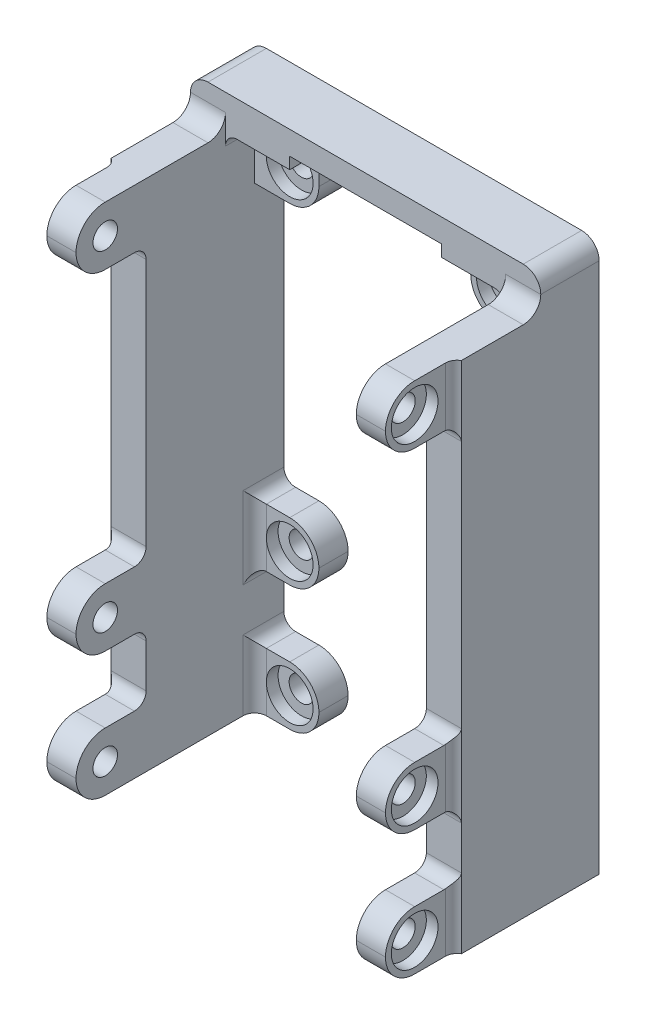
from build123d import *

# Parameters (mm, degrees)
SKETCH1_W               = 3
SKETCH1_H               = 44
BOSS_EXTRUDE1_DEPTH     = 11.8
BOSS_EXTRUDE1_2_DEPTH   = 11.8
SKETCH2_W               = 30
SKETCH2_H               = 3
BOSS_EXTRUDE2_DEPTH     = 5
SKETCH3_W               = 2.5
SKETCH3_H               = 5
BOSS_EXTRUDE3_DEPTH     = 6
CUT_EXTRUDE1_DEPTH      = 43.568650437
CUT_EXTRUDE1_DEPTH_BACK = 43.568650437
SKETCH4_R               = 1.05
SKETCH5_W               = 5.5
SKETCH5_H               = 5
SKETCH5_R               = 1.05
BOSS_EXTRUDE4_DEPTH     = 2.5
FILLET1_R               = 2.5
FILLET2_R               = 2.5
FILLET3_R               = 1.5
SKETCH8_R               = 2
CUT_EXTRUDE2_DEPTH      = 1
SKETCH9_R               = 2
CUT_EXTRUDE3_DEPTH      = 1
FILLET4_R               = 1
SKETCH10_W              = 13
SKETCH10_H              = 1
CUT_EXTRUDE4_DEPTH      = 35.159039843


# Some blends are built 0.0001 mm under size
with BuildPart() as part:
    # Sketch1 → Boss-Extrude1 (new body)
    with BuildSketch(Plane.XY):
        with Locations((-13.5, 0)):
            Rectangle(SKETCH1_W, SKETCH1_H)
    extrude(amount=BOSS_EXTRUDE1_DEPTH)



with BuildPart() as body_2:
    # Sketch1 → Boss-Extrude1 2 (new body)
    with BuildSketch(Plane.XY):
        with Locations((13.5, 0)):
            Rectangle(SKETCH1_W, SKETCH1_H)
    extrude(amount=BOSS_EXTRUDE1_2_DEPTH)


with BuildPart() as part_1:
    add(part.part)

    add(body_2.part)  # Boss-Extrude2 merges body 2
    # Sketch2 → Boss-Extrude2 (add)
    with BuildSketch(Plane(origin=(0, 0, 0), x_dir=(-1, 0, 0), z_dir=(0, 0, -1))):
        with Locations((0, 23.5)):
            Rectangle(SKETCH2_W, SKETCH2_H)
    extrude(amount=-BOSS_EXTRUDE2_DEPTH)

    # Sketch3 → Boss-Extrude3 (add)
    with BuildSketch(Plane.XY.offset(11.8)):
        with Locations((-13.25, 19.5)):
            Rectangle(SKETCH3_W, SKETCH3_H)
        with Locations((-13.25, -8.8)):
            Rectangle(SKETCH3_W, SKETCH3_H)
        with Locations((-13.25, -19.5)):
            Rectangle(SKETCH3_W, SKETCH3_H)
        with Locations((13.25, -19.5)):
            Rectangle(SKETCH3_W, SKETCH3_H)
        with Locations((13.25, -8.8)):
            Rectangle(SKETCH3_W, SKETCH3_H)
        with Locations((13.25, 19.5)):
            Rectangle(SKETCH3_W, SKETCH3_H)
    extrude(amount=BOSS_EXTRUDE3_DEPTH)

    # Sketch4 → Cut-Extrude1 (cut, two sides: drawn at the far end of the back side and taken through both)
    with BuildSketch(Plane.ZY.offset(14.5).offset(-CUT_EXTRUDE1_DEPTH_BACK)):
        with Locations((15.3, 19.5)):
            Circle(SKETCH4_R)
        with Locations((15.3, -8.8)):
            Circle(SKETCH4_R)
        with Locations((15.3, -19.5)):
            Circle(SKETCH4_R)
    extrude(amount=CUT_EXTRUDE1_DEPTH + CUT_EXTRUDE1_DEPTH_BACK, mode=Mode.SUBTRACT)

    # Sketch5 → Boss-Extrude4 (add)
    # profile 1 of 6: a face of its own
    with BuildSketch(Plane(origin=(0, 0, 0), x_dir=(-1, 0, 0), z_dir=(0, 0, -1))):
        with Locations((-9.25, 19.5)):
            Rectangle(SKETCH5_W, SKETCH5_H)
        with Locations((-9, 19.5)):
            Circle(SKETCH5_R, mode=Mode.SUBTRACT)
    # profile 2 of 6: a face of its own
    with BuildSketch(Plane(origin=(0, 0, 0), x_dir=(-1, 0, 0), z_dir=(0, 0, -1))):
        with Locations((9.25, 19.5)):
            Rectangle(SKETCH5_W, SKETCH5_H)
        with Locations(Location((9, 19.5, 0), (0, 0, 180))):
            Circle(SKETCH5_R, mode=Mode.SUBTRACT)
    # profile 3 of 6: a face of its own
    with BuildSketch(Plane(origin=(0, 0, 0), x_dir=(-1, 0, 0), z_dir=(0, 0, -1))):
        with Locations((-9.25, -8.8)):
            Rectangle(SKETCH5_W, SKETCH5_H)
        with Locations((-9, -8.8)):
            Circle(SKETCH5_R, mode=Mode.SUBTRACT)
    # profile 4 of 6: a face of its own
    with BuildSketch(Plane(origin=(0, 0, 0), x_dir=(-1, 0, 0), z_dir=(0, 0, -1))):
        with Locations((-9.25, -19.5)):
            Rectangle(SKETCH5_W, SKETCH5_H)
        with Locations((-9, -19.5)):
            Circle(SKETCH5_R, mode=Mode.SUBTRACT)
    # profile 5 of 6: a face of its own
    with BuildSketch(Plane(origin=(0, 0, 0), x_dir=(-1, 0, 0), z_dir=(0, 0, -1))):
        with Locations((9.25, -8.8)):
            Rectangle(SKETCH5_W, SKETCH5_H)
        with Locations(Location((9, -8.8, 0), (0, 0, 180))):
            Circle(SKETCH5_R, mode=Mode.SUBTRACT)
    # profile 6 of 6: a face of its own
    with BuildSketch(Plane(origin=(0, 0, 0), x_dir=(-1, 0, 0), z_dir=(0, 0, -1))):
        with Locations((9.25, -19.5)):
            Rectangle(SKETCH5_W, SKETCH5_H)
        with Locations(Location((9, -19.5, 0), (0, 0, 180))):
            Circle(SKETCH5_R, mode=Mode.SUBTRACT)
    extrude(amount=-BOSS_EXTRUDE4_DEPTH)

    # Fillet1
    fillet1_edges = [part_1.edges().sort_by_distance(p)[0] for p in [
        (6.5, 17, 1.25),
        (6.5, -6.3, 1.25),
        (6.5, -11.3, 1.25),
        (6.5, -17, 1.25),
        (6.5, -22, 1.25),
        (-6.5, -22, 1.25),
        (-6.5, -17, 1.25),
        (-6.5, -11.3, 1.25),
        (-6.5, -6.3, 1.25),
        (-6.5, 17, 1.25),
    ]]
    fillet(fillet1_edges, radius=FILLET1_R - 0.0001)  # a hair under: the kernel refuses the full size

    # Fillet2
    fillet2_edges = [part_1.edges().sort_by_distance(p)[0] for p in [
        (13.25, -6.3, 17.8),
        (13.25, -11.3, 17.8),
        (13.25, -17, 17.8),
        (13.25, -22, 17.8),
        (-13.25, -22, 17.8),
        (-13.25, -17, 17.8),
        (-13.25, -11.3, 17.8),
        (-13.25, -6.3, 17.8),
        (13.25, 22, 17.8),
        (13.25, 17, 17.8),
        (-13.25, 17, 17.8),
        (-13.25, 22, 17.8),
    ]]
    fillet(fillet2_edges, radius=FILLET2_R - 0.0001)  # a hair under: the kernel refuses the full size

    # Fillet3
    # the kernel refuses this fillet: 1.5 mm, written as the material it adds along each edge
    with BuildSketch(Plane(origin=(-12, 22, 5), x_dir=(0, 1, 0), z_dir=(-1, 0, 0))) as fillet3_piece_1:
        with BuildLine():
            CenterArc((FILLET3_R, -FILLET3_R), FILLET3_R, 90, 90)
            Line((0, -FILLET3_R), (0, 0))
            Line((0, 0), (FILLET3_R, 0))
        make_face()
    extrude(amount=3)
    with BuildSketch(Plane(origin=(15, 22, 5), x_dir=(0, 0, 1), z_dir=(-1, 0, 0))) as fillet3_piece_2:
        with BuildLine():
            CenterArc((FILLET3_R, FILLET3_R), FILLET3_R, 180, 90)
            Line((0, FILLET3_R), (0, 0))
            Line((0, 0), (FILLET3_R, 0))
        make_face()
    extrude(amount=3)
    # the kernel refuses this fillet: 1.5 mm, written as the material it takes off along each edge
    with BuildSketch(Plane(origin=(15, 25, -3.75), x_dir=(0, -1, 0), z_dir=(0, 0, 1))) as fillet3_2_piece_1:
        with BuildLine():
            CenterArc((FILLET3_R, -FILLET3_R), FILLET3_R, 90, 90)
            Line((0, -FILLET3_R), (0, 0))
            Line((0, 0), (FILLET3_R, 0))
        make_face()
    extrude(amount=12.5, mode=Mode.SUBTRACT)
    with BuildSketch(Plane(origin=(-15, 25, -3.75), x_dir=(0, -1, 0), z_dir=(0, 0, 1))) as fillet3_2_piece_2:
        with BuildLine():
            CenterArc((FILLET3_R, FILLET3_R), FILLET3_R, 180, 90)
            Line((0, FILLET3_R), (0, 0))
            Line((0, 0), (FILLET3_R, 0))
        make_face()
    extrude(amount=12.5, mode=Mode.SUBTRACT)

    # Sketch8 → Cut-Extrude2 (cut)
    with BuildSketch(Plane.ZY.offset(14.5)):
        with Locations((15.3, 19.5)):
            Circle(SKETCH8_R)
        with Locations((15.3, -8.8)):
            Circle(SKETCH8_R)
        with Locations((15.3, -19.5)):
            Circle(SKETCH8_R)
    cut_extrude2 = extrude(amount=-CUT_EXTRUDE2_DEPTH, mode=Mode.SUBTRACT)

    # Sketch9 → Cut-Extrude3 (cut)
    with BuildSketch(Plane.XY.offset(2.5)):
        with Locations((-9, 19.5)):
            Circle(SKETCH9_R)
        with Locations((-9, -8.8)):
            Circle(SKETCH9_R)
        with Locations((-9, -19.5)):
            Circle(SKETCH9_R)
    cut_extrude3 = extrude(amount=-CUT_EXTRUDE3_DEPTH, mode=Mode.SUBTRACT)

    # Mirror1: Cut-Extrude2, Cut-Extrude3 across plane
    add(cut_extrude2.mirror(Plane(origin=(0, 0, 0), x_dir=(0, 0, 1), z_dir=(1, 0, 0))), mode=Mode.SUBTRACT)
    add(cut_extrude3.mirror(Plane(origin=(0, 0, 0), x_dir=(0, 0, 1), z_dir=(1, 0, 0))), mode=Mode.SUBTRACT)

    # Fillet4
    # the kernel refuses this fillet: 1 mm, written as the material it adds along each edge
    with BuildSketch(Plane(origin=(12, 22, 0), x_dir=(0, -1, 0), z_dir=(0, 0, 1)), Plane(origin=(12, -11.3, 2.5), x_dir=(0, 0, 1), z_dir=(0, 1, 0)), Plane(origin=(12, -22, 2.5), x_dir=(0, 0, 1), z_dir=(0, 1, 0))) as fillet4_piece_1:
        with BuildLine():
            CenterArc((FILLET4_R, -FILLET4_R), FILLET4_R, 90, 90)
            Line((0, -FILLET4_R), (0, 0))
            Line((0, 0), (FILLET4_R, 0))
        make_face()
    extrude(amount=5)
    with BuildSketch(Plane(origin=(-12, 22, 0), x_dir=(0, -1, 0), z_dir=(0, 0, 1)), Plane(origin=(-12, -22, 2.5), x_dir=(0, 0, 1), z_dir=(0, 1, 0)), Plane(origin=(-12, -11.3, 2.5), x_dir=(0, 0, 1), z_dir=(0, 1, 0))) as fillet4_piece_2:
        with BuildLine():
            CenterArc((FILLET4_R, FILLET4_R), FILLET4_R, 180, 90)
            Line((0, FILLET4_R), (0, 0))
            Line((0, 0), (FILLET4_R, 0))
        make_face()
    extrude(amount=5)
    with BuildSketch(Plane(origin=(12, -6.3, 0), x_dir=(0, 1, 0), z_dir=(0, 0, 1)), Plane(origin=(12, -17, 0), x_dir=(0, 1, 0), z_dir=(0, 0, 1)), Plane(origin=(-12, -11.3, 0), x_dir=(0, -1, 0), z_dir=(0, 0, 1)), Plane(origin=(-14.5, 17, 11.8), x_dir=(0, 0, 1), z_dir=(1, 0, 0))) as fillet4_piece_3:
        with BuildLine():
            CenterArc((FILLET4_R, FILLET4_R), FILLET4_R, 180, 90)
            Line((0, FILLET4_R), (0, 0))
            Line((0, 0), (FILLET4_R, 0))
        make_face()
    extrude(amount=2.5)
    with BuildSketch(Plane(origin=(12, -11.3, 0), x_dir=(0, -1, 0), z_dir=(0, 0, 1)), Plane(origin=(-12, -17, 0), x_dir=(0, 1, 0), z_dir=(0, 0, 1)), Plane(origin=(-12, -6.3, 0), x_dir=(0, 1, 0), z_dir=(0, 0, 1)), Plane(origin=(-12, -6.3, 11.8), x_dir=(0, 1, 0), z_dir=(-1, 0, 0)), Plane(origin=(-12, -17, 11.8), x_dir=(0, 1, 0), z_dir=(-1, 0, 0)), Plane(origin=(14.5, -17, 11.8), x_dir=(0, 1, 0), z_dir=(-1, 0, 0)), Plane(origin=(14.5, -6.3, 11.8), x_dir=(0, 1, 0), z_dir=(-1, 0, 0)), Plane(origin=(-14.5, -11.3, 11.8), x_dir=(0, -1, 0), z_dir=(1, 0, 0)), Plane(origin=(12, -11.3, 11.8), x_dir=(0, -1, 0), z_dir=(1, 0, 0)), Plane(origin=(12, 17, 11.8), x_dir=(0, -1, 0), z_dir=(1, 0, 0))) as fillet4_piece_4:
        with BuildLine():
            CenterArc((FILLET4_R, -FILLET4_R), FILLET4_R, 90, 90)
            Line((0, -FILLET4_R), (0, 0))
            Line((0, 0), (FILLET4_R, 0))
        make_face()
    extrude(amount=2.5)
    with BuildSketch(Plane(origin=(-14.5, 22, 11.8), x_dir=(-1, 0, 0), z_dir=(0, -1, 0)), Plane(origin=(-14.5, -6.3, 11.8), x_dir=(-1, 0, 0), z_dir=(0, -1, 0)), Plane(origin=(-14.5, -17, 11.8), x_dir=(-1, 0, 0), z_dir=(0, -1, 0)), Plane(origin=(14.5, -22, 11.8), x_dir=(1, 0, 0), z_dir=(0, 1, 0)), Plane(origin=(14.5, -11.3, 11.8), x_dir=(1, 0, 0), z_dir=(0, 1, 0))) as fillet4_piece_5:
        with BuildLine():
            CenterArc((1, -0.866025404), FILLET4_R, 120, 60)
            Line((0, -0.866025404), (0, 0))
            Line((0, 0), (0.5, 0))
        make_face()
    extrude(amount=5)
    with BuildSketch(Plane(origin=(14.5, 17, 11.8), x_dir=(0, 0, 1), z_dir=(0, 1, 0))) as fillet4_piece_6:
        with BuildLine():
            CenterArc((0.866025404, 1), FILLET4_R, 210, 60)
            Line((0, 0.5), (0, 0))
            Line((0, 0), (0.866025404, 0))
        make_face()
    extrude(amount=5)
    with BuildSketch(Plane(origin=(12, -11.3, 2.5), x_dir=(0, 0, 1), z_dir=(0, 1, 0))) as fillet4_piece_7a_section:
        with BuildLine():
            CenterArc((FILLET4_R, -FILLET4_R), FILLET4_R, 90, 90)
            Line((0, -FILLET4_R), (0, 0))
            Line((0, 0), (FILLET4_R, 0))
        make_face()
    fillet4_piece_7a = extrude(amount=7.5, mode=Mode.PRIVATE)
    fillet4_piece_7a = split(fillet4_piece_7a, bisect_by=Plane(origin=(12, -6.3, 2.5), z_dir=(0, 1, 0)), keep=Keep.TOP, mode=Mode.PRIVATE)
    with BuildSketch(Plane(origin=(12, -6.3, 0), x_dir=(0, 1, 0), z_dir=(0, 0, 1))) as fillet4_piece_7b_section:
        with BuildLine():
            CenterArc((FILLET4_R, FILLET4_R), FILLET4_R, 180, 90)
            Line((0, FILLET4_R), (0, 0))
            Line((0, 0), (FILLET4_R, 0))
        make_face()
    fillet4_piece_7b = extrude(amount=5, mode=Mode.PRIVATE)
    fillet4_piece_7b = split(fillet4_piece_7b, bisect_by=Plane(origin=(12, -6.3, 2.5), z_dir=(0, 0, 1)), keep=Keep.TOP, mode=Mode.PRIVATE)
    fillet4_piece_7 = fillet4_piece_7a & fillet4_piece_7b
    add(fillet4_piece_7)
    with BuildSketch(Plane(origin=(12, -22, 2.5), x_dir=(0, 0, 1), z_dir=(0, 1, 0))) as fillet4_piece_8a_section:
        with BuildLine():
            CenterArc((FILLET4_R, -FILLET4_R), FILLET4_R, 90, 90)
            Line((0, -FILLET4_R), (0, 0))
            Line((0, 0), (FILLET4_R, 0))
        make_face()
    fillet4_piece_8a = extrude(amount=7.5, mode=Mode.PRIVATE)
    fillet4_piece_8a = split(fillet4_piece_8a, bisect_by=Plane(origin=(12, -17, 2.5), z_dir=(0, 1, 0)), keep=Keep.TOP, mode=Mode.PRIVATE)
    with BuildSketch(Plane(origin=(12, -17, 0), x_dir=(0, 1, 0), z_dir=(0, 0, 1))) as fillet4_piece_8b_section:
        with BuildLine():
            CenterArc((FILLET4_R, FILLET4_R), FILLET4_R, 180, 90)
            Line((0, FILLET4_R), (0, 0))
            Line((0, 0), (FILLET4_R, 0))
        make_face()
    fillet4_piece_8b = extrude(amount=5, mode=Mode.PRIVATE)
    fillet4_piece_8b = split(fillet4_piece_8b, bisect_by=Plane(origin=(12, -17, 2.5), z_dir=(0, 0, 1)), keep=Keep.TOP, mode=Mode.PRIVATE)
    fillet4_piece_8 = fillet4_piece_8a & fillet4_piece_8b
    add(fillet4_piece_8)
    with BuildSketch(Plane(origin=(12, -11.3, 0), x_dir=(0, -1, 0), z_dir=(0, 0, 1))) as fillet4_piece_9a_section:
        with BuildLine():
            CenterArc((FILLET4_R, -FILLET4_R), FILLET4_R, 90, 90)
            Line((0, -FILLET4_R), (0, 0))
            Line((0, 0), (FILLET4_R, 0))
        make_face()
    fillet4_piece_9a = extrude(amount=5, mode=Mode.PRIVATE)
    fillet4_piece_9a = split(fillet4_piece_9a, bisect_by=Plane(origin=(12, -11.3, 2.5), z_dir=(0, 0, 1)), keep=Keep.TOP, mode=Mode.PRIVATE)
    with BuildSketch(Plane(origin=(12, -13.8, 2.5), x_dir=(0, 0, 1), z_dir=(0, 1, 0))) as fillet4_piece_9b_section:
        with BuildLine():
            CenterArc((FILLET4_R, -FILLET4_R), FILLET4_R, 90, 90)
            Line((0, -FILLET4_R), (0, 0))
            Line((0, 0), (FILLET4_R, 0))
        make_face()
    fillet4_piece_9b = extrude(amount=7.5, mode=Mode.PRIVATE)
    fillet4_piece_9b = split(fillet4_piece_9b, bisect_by=Plane(origin=(12, -11.3, 2.5), z_dir=(0, -1, 0)), keep=Keep.TOP, mode=Mode.PRIVATE)
    fillet4_piece_9 = fillet4_piece_9a & fillet4_piece_9b
    add(fillet4_piece_9)
    with BuildSketch(Plane(origin=(-12, -11.3, 0), x_dir=(0, -1, 0), z_dir=(0, 0, 1))) as fillet4_piece_10a_section:
        with BuildLine():
            CenterArc((FILLET4_R, FILLET4_R), FILLET4_R, 180, 90)
            Line((0, FILLET4_R), (0, 0))
            Line((0, 0), (FILLET4_R, 0))
        make_face()
    fillet4_piece_10a = extrude(amount=5, mode=Mode.PRIVATE)
    fillet4_piece_10a = split(fillet4_piece_10a, bisect_by=Plane(origin=(-12, -11.3, 2.5), z_dir=(0, 0, 1)), keep=Keep.TOP, mode=Mode.PRIVATE)
    with BuildSketch(Plane(origin=(-12, -13.8, 2.5), x_dir=(0, 0, 1), z_dir=(0, 1, 0))) as fillet4_piece_10b_section:
        with BuildLine():
            CenterArc((FILLET4_R, FILLET4_R), FILLET4_R, 180, 90)
            Line((0, FILLET4_R), (0, 0))
            Line((0, 0), (FILLET4_R, 0))
        make_face()
    fillet4_piece_10b = extrude(amount=7.5, mode=Mode.PRIVATE)
    fillet4_piece_10b = split(fillet4_piece_10b, bisect_by=Plane(origin=(-12, -11.3, 2.5), z_dir=(0, -1, 0)), keep=Keep.TOP, mode=Mode.PRIVATE)
    fillet4_piece_10 = fillet4_piece_10a & fillet4_piece_10b
    add(fillet4_piece_10)
    with BuildSketch(Plane(origin=(-12, -22, 2.5), x_dir=(0, 0, 1), z_dir=(0, 1, 0))) as fillet4_piece_11a_section:
        with BuildLine():
            CenterArc((FILLET4_R, FILLET4_R), FILLET4_R, 180, 90)
            Line((0, FILLET4_R), (0, 0))
            Line((0, 0), (FILLET4_R, 0))
        make_face()
    fillet4_piece_11a = extrude(amount=7.5, mode=Mode.PRIVATE)
    fillet4_piece_11a = split(fillet4_piece_11a, bisect_by=Plane(origin=(-12, -17, 2.5), z_dir=(0, 1, 0)), keep=Keep.TOP, mode=Mode.PRIVATE)
    with BuildSketch(Plane(origin=(-12, -17, 0), x_dir=(0, 1, 0), z_dir=(0, 0, 1))) as fillet4_piece_11b_section:
        with BuildLine():
            CenterArc((FILLET4_R, -FILLET4_R), FILLET4_R, 90, 90)
            Line((0, -FILLET4_R), (0, 0))
            Line((0, 0), (FILLET4_R, 0))
        make_face()
    fillet4_piece_11b = extrude(amount=5, mode=Mode.PRIVATE)
    fillet4_piece_11b = split(fillet4_piece_11b, bisect_by=Plane(origin=(-12, -17, 2.5), z_dir=(0, 0, 1)), keep=Keep.TOP, mode=Mode.PRIVATE)
    fillet4_piece_11 = fillet4_piece_11a & fillet4_piece_11b
    add(fillet4_piece_11)
    with BuildSketch(Plane(origin=(-12, -11.3, 2.5), x_dir=(0, 0, 1), z_dir=(0, 1, 0))) as fillet4_piece_12a_section:
        with BuildLine():
            CenterArc((FILLET4_R, FILLET4_R), FILLET4_R, 180, 90)
            Line((0, FILLET4_R), (0, 0))
            Line((0, 0), (FILLET4_R, 0))
        make_face()
    fillet4_piece_12a = extrude(amount=7.5, mode=Mode.PRIVATE)
    fillet4_piece_12a = split(fillet4_piece_12a, bisect_by=Plane(origin=(-12, -6.3, 2.5), z_dir=(0, 1, 0)), keep=Keep.TOP, mode=Mode.PRIVATE)
    with BuildSketch(Plane(origin=(-12, -6.3, 0), x_dir=(0, 1, 0), z_dir=(0, 0, 1))) as fillet4_piece_12b_section:
        with BuildLine():
            CenterArc((FILLET4_R, -FILLET4_R), FILLET4_R, 90, 90)
            Line((0, -FILLET4_R), (0, 0))
            Line((0, 0), (FILLET4_R, 0))
        make_face()
    fillet4_piece_12b = extrude(amount=5, mode=Mode.PRIVATE)
    fillet4_piece_12b = split(fillet4_piece_12b, bisect_by=Plane(origin=(-12, -6.3, 2.5), z_dir=(0, 0, 1)), keep=Keep.TOP, mode=Mode.PRIVATE)
    fillet4_piece_12 = fillet4_piece_12a & fillet4_piece_12b
    add(fillet4_piece_12)
    with BuildSketch(Plane(origin=(-17, 17, 11.8), x_dir=(0, 0, 1), z_dir=(1, 0, 0))) as fillet4_piece_13a_section:
        with BuildLine():
            CenterArc((FILLET4_R, FILLET4_R), FILLET4_R, 180, 90)
            Line((0, FILLET4_R), (0, 0))
            Line((0, 0), (FILLET4_R, 0))
        make_face()
    fillet4_piece_13a = extrude(amount=5, mode=Mode.PRIVATE)
    fillet4_piece_13a = split(fillet4_piece_13a, bisect_by=Plane(origin=(-15, 17, 11.8), z_dir=(1, 0, 0)), keep=Keep.TOP, mode=Mode.PRIVATE)
    fillet4_piece_13a = split(fillet4_piece_13a, bisect_by=Plane(origin=(-14.5, 17, 11.8), z_dir=(-1, 0, 0)), keep=Keep.TOP, mode=Mode.PRIVATE)
    with BuildSketch(Plane(origin=(-14.5, 22, 11.8), x_dir=(-1, 0, 0), z_dir=(0, -1, 0))) as fillet4_piece_13b_section:
        with BuildLine():
            CenterArc((1, -0.866025404), FILLET4_R, 120, 60)
            Line((0, -0.866025404), (0, 0))
            Line((0, 0), (0.5, 0))
        make_face()
    fillet4_piece_13b = extrude(amount=7.165063509, mode=Mode.PRIVATE)
    fillet4_piece_13b = split(fillet4_piece_13b, bisect_by=Plane(origin=(-14.5, 17, 11.8), z_dir=(0, -1, 0)), keep=Keep.TOP, mode=Mode.PRIVATE)
    fillet4_piece_13 = fillet4_piece_13a & fillet4_piece_13b
    add(fillet4_piece_13)
    with BuildSketch(Plane(origin=(-12, -6.3, 11.8), x_dir=(0, 1, 0), z_dir=(-1, 0, 0))) as fillet4_piece_14a_section:
        with BuildLine():
            CenterArc((FILLET4_R, -FILLET4_R), FILLET4_R, 90, 90)
            Line((0, -FILLET4_R), (0, 0))
            Line((0, 0), (FILLET4_R, 0))
        make_face()
    fillet4_piece_14a = extrude(amount=5, mode=Mode.PRIVATE)
    fillet4_piece_14a = split(fillet4_piece_14a, bisect_by=Plane(origin=(-15, -6.3, 11.8), z_dir=(1, 0, 0)), keep=Keep.TOP, mode=Mode.PRIVATE)
    fillet4_piece_14a = split(fillet4_piece_14a, bisect_by=Plane(origin=(-14.5, -6.3, 11.8), z_dir=(-1, 0, 0)), keep=Keep.TOP, mode=Mode.PRIVATE)
    with BuildSketch(Plane(origin=(-14.5, -4.134936491, 11.8), x_dir=(-1, 0, 0), z_dir=(0, -1, 0))) as fillet4_piece_14b_section:
        with BuildLine():
            CenterArc((1, -0.866025404), FILLET4_R, 120, 60)
            Line((0, -0.866025404), (0, 0))
            Line((0, 0), (0.5, 0))
        make_face()
    fillet4_piece_14b = extrude(amount=7.165063509, mode=Mode.PRIVATE)
    fillet4_piece_14b = split(fillet4_piece_14b, bisect_by=Plane(origin=(-14.5, -6.3, 11.8), z_dir=(0, 1, 0)), keep=Keep.TOP, mode=Mode.PRIVATE)
    fillet4_piece_14 = fillet4_piece_14a & fillet4_piece_14b
    add(fillet4_piece_14)
    with BuildSketch(Plane(origin=(-14.5, -6.3, 11.8), x_dir=(-1, 0, 0), z_dir=(0, -1, 0))) as fillet4_piece_15a_section:
        with BuildLine():
            CenterArc((1, -0.866025404), FILLET4_R, 120, 60)
            Line((0, -0.866025404), (0, 0))
            Line((0, 0), (0.5, 0))
        make_face()
    fillet4_piece_15a = extrude(amount=7.165063509, mode=Mode.PRIVATE)
    fillet4_piece_15a = split(fillet4_piece_15a, bisect_by=Plane(origin=(-14.5, -11.3, 11.8), z_dir=(0, -1, 0)), keep=Keep.TOP, mode=Mode.PRIVATE)
    with BuildSketch(Plane(origin=(-17, -11.3, 11.8), x_dir=(0, -1, 0), z_dir=(1, 0, 0))) as fillet4_piece_15b_section:
        with BuildLine():
            CenterArc((FILLET4_R, -FILLET4_R), FILLET4_R, 90, 90)
            Line((0, -FILLET4_R), (0, 0))
            Line((0, 0), (FILLET4_R, 0))
        make_face()
    fillet4_piece_15b = extrude(amount=5, mode=Mode.PRIVATE)
    fillet4_piece_15b = split(fillet4_piece_15b, bisect_by=Plane(origin=(-15, -11.3, 11.8), z_dir=(1, 0, 0)), keep=Keep.TOP, mode=Mode.PRIVATE)
    fillet4_piece_15b = split(fillet4_piece_15b, bisect_by=Plane(origin=(-14.5, -11.3, 11.8), z_dir=(-1, 0, 0)), keep=Keep.TOP, mode=Mode.PRIVATE)
    fillet4_piece_15 = fillet4_piece_15a & fillet4_piece_15b
    add(fillet4_piece_15)
    with BuildSketch(Plane(origin=(-12, -17, 11.8), x_dir=(0, 1, 0), z_dir=(-1, 0, 0))) as fillet4_piece_16a_section:
        with BuildLine():
            CenterArc((FILLET4_R, -FILLET4_R), FILLET4_R, 90, 90)
            Line((0, -FILLET4_R), (0, 0))
            Line((0, 0), (FILLET4_R, 0))
        make_face()
    fillet4_piece_16a = extrude(amount=5, mode=Mode.PRIVATE)
    fillet4_piece_16a = split(fillet4_piece_16a, bisect_by=Plane(origin=(-15, -17, 11.8), z_dir=(1, 0, 0)), keep=Keep.TOP, mode=Mode.PRIVATE)
    fillet4_piece_16a = split(fillet4_piece_16a, bisect_by=Plane(origin=(-14.5, -17, 11.8), z_dir=(-1, 0, 0)), keep=Keep.TOP, mode=Mode.PRIVATE)
    with BuildSketch(Plane(origin=(-14.5, -14.834936491, 11.8), x_dir=(-1, 0, 0), z_dir=(0, -1, 0))) as fillet4_piece_16b_section:
        with BuildLine():
            CenterArc((1, -0.866025404), FILLET4_R, 120, 60)
            Line((0, -0.866025404), (0, 0))
            Line((0, 0), (0.5, 0))
        make_face()
    fillet4_piece_16b = extrude(amount=7.165063509, mode=Mode.PRIVATE)
    fillet4_piece_16b = split(fillet4_piece_16b, bisect_by=Plane(origin=(-14.5, -17, 11.8), z_dir=(0, 1, 0)), keep=Keep.TOP, mode=Mode.PRIVATE)
    fillet4_piece_16 = fillet4_piece_16a & fillet4_piece_16b
    add(fillet4_piece_16)
    with BuildSketch(Plane(origin=(14.5, -22, 11.8), x_dir=(1, 0, 0), z_dir=(0, 1, 0))) as fillet4_piece_17a_section:
        with BuildLine():
            CenterArc((1, -0.866025404), FILLET4_R, 120, 60)
            Line((0, -0.866025404), (0, 0))
            Line((0, 0), (0.5, 0))
        make_face()
    fillet4_piece_17a = extrude(amount=7.165063509, mode=Mode.PRIVATE)
    fillet4_piece_17a = split(fillet4_piece_17a, bisect_by=Plane(origin=(14.5, -17, 11.8), z_dir=(0, 1, 0)), keep=Keep.TOP, mode=Mode.PRIVATE)
    with BuildSketch(Plane(origin=(17, -17, 11.8), x_dir=(0, 1, 0), z_dir=(-1, 0, 0))) as fillet4_piece_17b_section:
        with BuildLine():
            CenterArc((FILLET4_R, -FILLET4_R), FILLET4_R, 90, 90)
            Line((0, -FILLET4_R), (0, 0))
            Line((0, 0), (FILLET4_R, 0))
        make_face()
    fillet4_piece_17b = extrude(amount=5, mode=Mode.PRIVATE)
    fillet4_piece_17b = split(fillet4_piece_17b, bisect_by=Plane(origin=(15, -17, 11.8), z_dir=(-1, 0, 0)), keep=Keep.TOP, mode=Mode.PRIVATE)
    fillet4_piece_17b = split(fillet4_piece_17b, bisect_by=Plane(origin=(14.5, -17, 11.8), z_dir=(1, 0, 0)), keep=Keep.TOP, mode=Mode.PRIVATE)
    fillet4_piece_17 = fillet4_piece_17a & fillet4_piece_17b
    add(fillet4_piece_17)
    with BuildSketch(Plane(origin=(14.5, -11.3, 11.8), x_dir=(1, 0, 0), z_dir=(0, 1, 0))) as fillet4_piece_18a_section:
        with BuildLine():
            CenterArc((1, -0.866025404), FILLET4_R, 120, 60)
            Line((0, -0.866025404), (0, 0))
            Line((0, 0), (0.5, 0))
        make_face()
    fillet4_piece_18a = extrude(amount=7.165063509, mode=Mode.PRIVATE)
    fillet4_piece_18a = split(fillet4_piece_18a, bisect_by=Plane(origin=(14.5, -6.3, 11.8), z_dir=(0, 1, 0)), keep=Keep.TOP, mode=Mode.PRIVATE)
    with BuildSketch(Plane(origin=(17, -6.3, 11.8), x_dir=(0, 1, 0), z_dir=(-1, 0, 0))) as fillet4_piece_18b_section:
        with BuildLine():
            CenterArc((FILLET4_R, -FILLET4_R), FILLET4_R, 90, 90)
            Line((0, -FILLET4_R), (0, 0))
            Line((0, 0), (FILLET4_R, 0))
        make_face()
    fillet4_piece_18b = extrude(amount=5, mode=Mode.PRIVATE)
    fillet4_piece_18b = split(fillet4_piece_18b, bisect_by=Plane(origin=(15, -6.3, 11.8), z_dir=(-1, 0, 0)), keep=Keep.TOP, mode=Mode.PRIVATE)
    fillet4_piece_18b = split(fillet4_piece_18b, bisect_by=Plane(origin=(14.5, -6.3, 11.8), z_dir=(1, 0, 0)), keep=Keep.TOP, mode=Mode.PRIVATE)
    fillet4_piece_18 = fillet4_piece_18a & fillet4_piece_18b
    add(fillet4_piece_18)
    with BuildSketch(Plane(origin=(12, -11.3, 11.8), x_dir=(0, -1, 0), z_dir=(1, 0, 0))) as fillet4_piece_19a_section:
        with BuildLine():
            CenterArc((FILLET4_R, -FILLET4_R), FILLET4_R, 90, 90)
            Line((0, -FILLET4_R), (0, 0))
            Line((0, 0), (FILLET4_R, 0))
        make_face()
    fillet4_piece_19a = extrude(amount=5, mode=Mode.PRIVATE)
    fillet4_piece_19a = split(fillet4_piece_19a, bisect_by=Plane(origin=(15, -11.3, 11.8), z_dir=(-1, 0, 0)), keep=Keep.TOP, mode=Mode.PRIVATE)
    fillet4_piece_19a = split(fillet4_piece_19a, bisect_by=Plane(origin=(14.5, -11.3, 11.8), z_dir=(1, 0, 0)), keep=Keep.TOP, mode=Mode.PRIVATE)
    with BuildSketch(Plane(origin=(14.5, -13.465063509, 11.8), x_dir=(1, 0, 0), z_dir=(0, 1, 0))) as fillet4_piece_19b_section:
        with BuildLine():
            CenterArc((1, -0.866025404), FILLET4_R, 120, 60)
            Line((0, -0.866025404), (0, 0))
            Line((0, 0), (0.5, 0))
        make_face()
    fillet4_piece_19b = extrude(amount=7.165063509, mode=Mode.PRIVATE)
    fillet4_piece_19b = split(fillet4_piece_19b, bisect_by=Plane(origin=(14.5, -11.3, 11.8), z_dir=(0, -1, 0)), keep=Keep.TOP, mode=Mode.PRIVATE)
    fillet4_piece_19 = fillet4_piece_19a & fillet4_piece_19b
    add(fillet4_piece_19)
    with BuildSketch(Plane(origin=(14.5, 14.834936491, 11.8), x_dir=(0, 0, 1), z_dir=(0, 1, 0))) as fillet4_piece_20a_section:
        with BuildLine():
            CenterArc((0.866025404, 1), FILLET4_R, 210, 60)
            Line((0, 0.5), (0, 0))
            Line((0, 0), (0.866025404, 0))
        make_face()
    fillet4_piece_20a = extrude(amount=7.165063509, mode=Mode.PRIVATE)
    fillet4_piece_20a = split(fillet4_piece_20a, bisect_by=Plane(origin=(14.5, 17, 11.8), z_dir=(0, -1, 0)), keep=Keep.TOP, mode=Mode.PRIVATE)
    with BuildSketch(Plane(origin=(12, 17, 11.8), x_dir=(0, -1, 0), z_dir=(1, 0, 0))) as fillet4_piece_20b_section:
        with BuildLine():
            CenterArc((FILLET4_R, -FILLET4_R), FILLET4_R, 90, 90)
            Line((0, -FILLET4_R), (0, 0))
            Line((0, 0), (FILLET4_R, 0))
        make_face()
    fillet4_piece_20b = extrude(amount=5, mode=Mode.PRIVATE)
    fillet4_piece_20b = split(fillet4_piece_20b, bisect_by=Plane(origin=(15, 17, 11.8), z_dir=(-1, 0, 0)), keep=Keep.TOP, mode=Mode.PRIVATE)
    fillet4_piece_20b = split(fillet4_piece_20b, bisect_by=Plane(origin=(14.5, 17, 11.8), z_dir=(1, 0, 0)), keep=Keep.TOP, mode=Mode.PRIVATE)
    fillet4_piece_20 = fillet4_piece_20a & fillet4_piece_20b
    add(fillet4_piece_20)

    # Sketch10 → Cut-Extrude4 (cut, through all)
    with BuildSketch(Plane(origin=(0, 0, 0), x_dir=(-1, 0, 0), z_dir=(0, 0, -1))):
        with Locations((0, 22.5)):
            Rectangle(SKETCH10_W, SKETCH10_H)
    extrude(amount=-CUT_EXTRUDE4_DEPTH, mode=Mode.SUBTRACT)


solid = part_1.part
